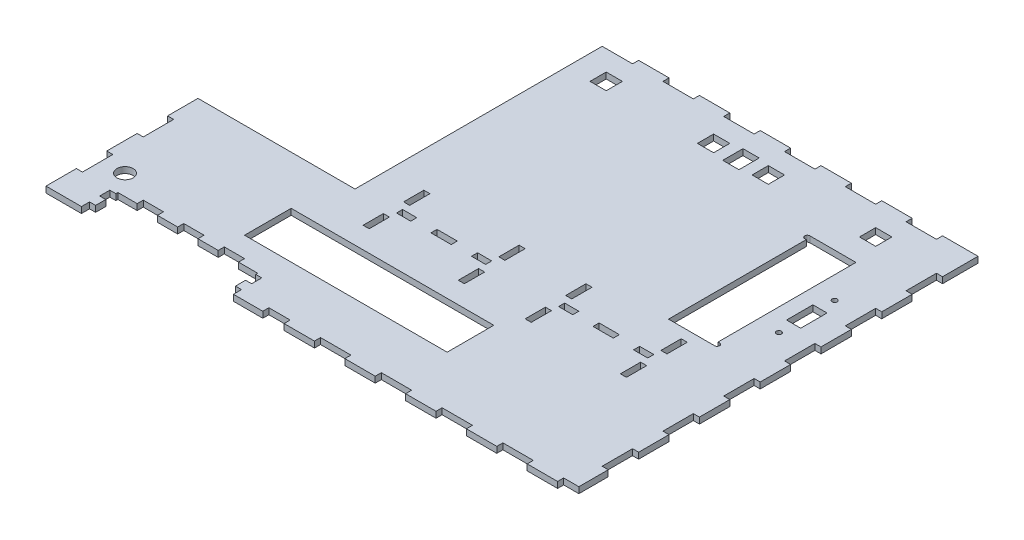
from build123d import *

# Parameters (mm, degrees)
CROQUIS1_W              = 10
CROQUIS1_H              = 3
CROQUIS1_W_2            = 3
CROQUIS1_H_2            = 10
CROQUIS1_W_3            = 7
CROQUIS1_W_4            = 8
CROQUIS1_H_3            = 8
SALIENTE_EXTRUIR1_DEPTH = 3
SKETCH1_R               = 1.25
SKETCH1_W               = 7
SKETCH1_H               = 13
CUT_EXTRUDE2_DEPTH      = 10
SKETCH2_W               = 8
SKETCH2_H               = 10
CUT_EXTRUDE3_DEPTH      = 10
SKETCH3_R               = 4
CUT_EXTRUDE4_DEPTH      = 10


with BuildPart() as part:
    # Croquis1 → Saliente-Extruir1 (new body)
    with BuildSketch(Plane(origin=(0, 0, 0), x_dir=(1, 0, 0), z_dir=(0, 1, 0))):
        Polygon((17.5, 79), (20.5, 79), (20.5, 80), (25.626440042, 80), (30, 80), (30, 83), (40, 83), (40, 80), (50, 80), (50, 83), (60, 83), (60, 80), (70, 80), (70, 83), (80, 83), (80, 80), (84.373559958, 80), (89.5, 80), (89.5, 79), (92.5, 79), (92.5, 74), (89.5, 74), (89.5, 69), (92.5, 69), (92.5, 65), (107, 65), (107, 68), (117.5, 68), (117.5, 65), (132.5, 65), (132.5, 68), (147.5, 68), (147.5, 65), (162.5, 65), (162.5, 68), (177.5, 68), (177.5, 65), (192.5, 65), (192.5, 68), (207.5, 68), (207.5, 65), (222.5, 65), (222.5, 68), (237.5, 68), (237.5, 65), (252.5, 65), (252.5, 68), (260, 68), (260, 82.5), (257, 82.5), (257, 97.5), (260, 97.5), (260, 112.5), (257, 112.5), (257, 127.5), (260, 127.5), (260, 142.5), (257, 142.5), (257, 157.5), (260, 157.5), (260, 172.5), (257, 172.5), (257, 187.5), (260, 187.5), (260, 202.5), (257, 202.5), (257, 217.5), (260, 217.5), (260, 232.5), (257, 232.5), (257, 247.5), (260, 247.5), (260, 265), (242.5, 265), (242.5, 262), (227.5, 262), (227.5, 265), (212.5, 265), (212.5, 262), (197.5, 262), (197.5, 265), (182.5, 265), (182.5, 262), (167.5, 262), (167.5, 265), (152.5, 265), (152.5, 262), (137.5, 262), (137.5, 265), (122.5, 265), (122.5, 262), (107.5, 262), (107.5, 265), (92.5, 265), (92.5, 262), (77.5, 262), (77.5, 155), (77.5, 140), (3, 140), (0, 140), (0, 125), (3, 125), (3, 110), (0, 110), (0, 95), (3, 95), (3, 80), (0, 80), (0, 65), (17.5, 65), (17.5, 69), (20.5, 69), (20.5, 74), (17.5, 74), align=None)
        with Locations((120, 141.5)):
            Rectangle(CROQUIS1_W, CROQUIS1_H, mode=Mode.SUBTRACT)
        Polygon((120, 93), (70, 93), (70, 116), (170, 116), (170, 93), align=None, mode=Mode.SUBTRACT)
        with Locations((200, 141.5)):
            Rectangle(CROQUIS1_W, CROQUIS1_H, mode=Mode.SUBTRACT)
        with Locations((96.5, 151.5)):
            Rectangle(CROQUIS1_W_2, CROQUIS1_H_2, mode=Mode.SUBTRACT)
        with Locations((96.5, 131.5)):
            Rectangle(CROQUIS1_W_2, CROQUIS1_H_2, mode=Mode.SUBTRACT)
        with Locations((101.5, 141.5)):
            Rectangle(CROQUIS1_W_3, CROQUIS1_H, mode=Mode.SUBTRACT)
        with Locations((143.5, 151.5)):
            Rectangle(CROQUIS1_W_2, CROQUIS1_H_2, mode=Mode.SUBTRACT)
        with Locations((143.5, 131.5)):
            Rectangle(CROQUIS1_W_2, CROQUIS1_H_2, mode=Mode.SUBTRACT)
        with Locations((176.5, 151.5)):
            Rectangle(CROQUIS1_W_2, CROQUIS1_H_2, mode=Mode.SUBTRACT)
        with Locations((138.5, 141.5)):
            Rectangle(CROQUIS1_W_3, CROQUIS1_H, mode=Mode.SUBTRACT)
        with Locations((181.5, 141.5)):
            Rectangle(CROQUIS1_W_3, CROQUIS1_H, mode=Mode.SUBTRACT)
        with Locations((223.5, 151.5)):
            Rectangle(CROQUIS1_W_2, CROQUIS1_H_2, mode=Mode.SUBTRACT)
        with Locations((218.5, 141.5)):
            Rectangle(CROQUIS1_W_3, CROQUIS1_H, mode=Mode.SUBTRACT)
        with Locations((176.5, 131.5)):
            Rectangle(CROQUIS1_W_2, CROQUIS1_H_2, mode=Mode.SUBTRACT)
        with Locations((223.5, 131.5)):
            Rectangle(CROQUIS1_W_2, CROQUIS1_H_2, mode=Mode.SUBTRACT)
        with Locations((93.5, 248)):
            Rectangle(CROQUIS1_W_4, CROQUIS1_H_3, mode=Mode.SUBTRACT)
        with Locations((146.5, 248)):
            Rectangle(CROQUIS1_W_4, CROQUIS1_H_3, mode=Mode.SUBTRACT)
        with Locations((173.5, 248)):
            Rectangle(CROQUIS1_W_4, CROQUIS1_H_3, mode=Mode.SUBTRACT)
        with Locations((226.5, 248)):
            Rectangle(CROQUIS1_W_4, CROQUIS1_H_3, mode=Mode.SUBTRACT)
    extrude(amount=SALIENTE_EXTRUIR1_DEPTH)

    # Sketch1 → Cut-Extrude2 (cut)
    with BuildSketch(Plane.XZ):
        with Locations((243.5, -210.75)):
            Circle(SKETCH1_R)
        with Locations((243.5, -183.25)):
            Circle(SKETCH1_R)
        with Locations((243.5, -197)):
            Rectangle(SKETCH1_W, SKETCH1_H)
        with BuildLine():
            Line((210.5, -161.75), (232.5, -161.75))
            Line((232.5, -161.75), (233.25, -161.75))
            ThreePointArc((233.25, -161.75), (234.5, -163), (233.25, -164.25))
            Line((233.25, -164.25), (232.5, -164.25))
            Line((232.5, -164.25), (232.5, -232.25))
            Line((232.5, -232.25), (211, -232.25))
            Line((211, -232.25), (209.75, -232.25))
            ThreePointArc((209.75, -232.25), (208.5, -231), (209.75, -229.75))
            Line((209.75, -229.75), (210.5, -229.75))
            Line((210.5, -229.75), (210.5, -161.75))
        make_face()
    extrude(amount=-CUT_EXTRUDE2_DEPTH, mode=Mode.SUBTRACT)

    # Sketch2 → Cut-Extrude3 (cut)
    with BuildSketch(Plane(origin=(0, 3, 0), x_dir=(1, 0, 0), z_dir=(0, 1, 0))):
        with Locations((160, 248)):
            Rectangle(SKETCH2_W, SKETCH2_H)
    extrude(amount=-CUT_EXTRUDE3_DEPTH, mode=Mode.SUBTRACT)

    # Sketch3 → Cut-Extrude4 (cut)
    with BuildSketch(Plane(origin=(0, 3, 0), x_dir=(1, 0, 0), z_dir=(0, 1, 0))):
        with Locations((14, 90)):
            Circle(SKETCH3_R)
    extrude(amount=-CUT_EXTRUDE4_DEPTH, mode=Mode.SUBTRACT)


solid = part.part
